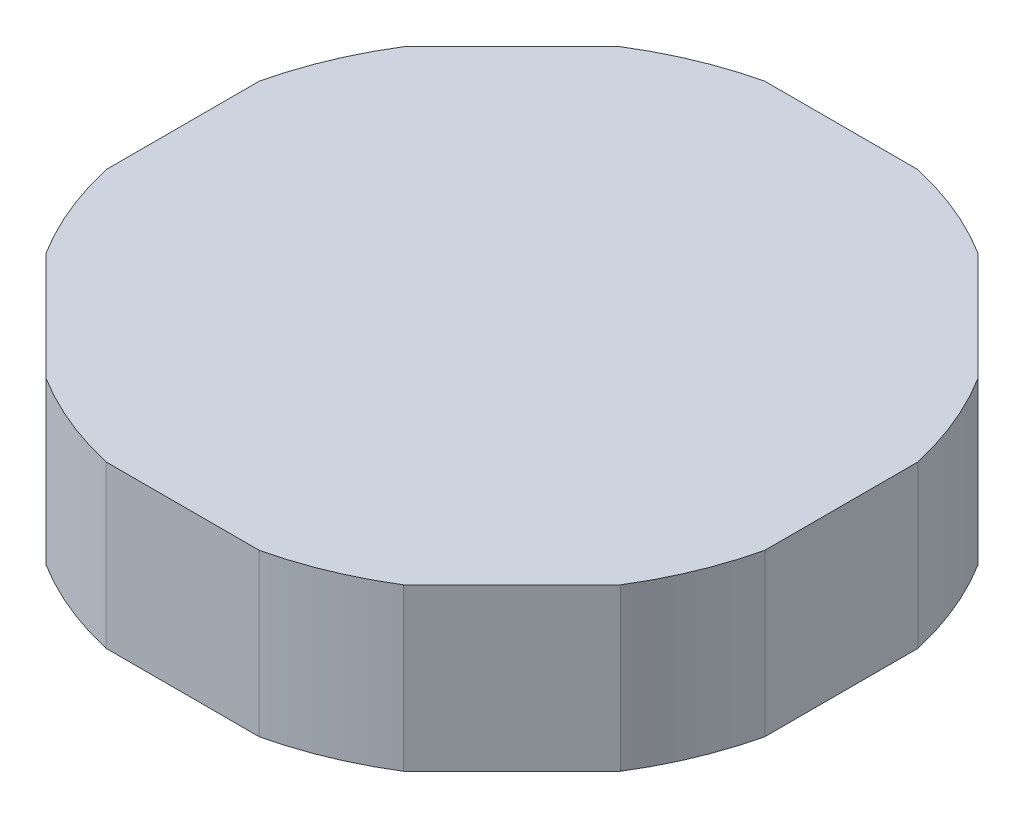
from build123d import *

# Parameters (mm, degrees)
SKETCH1_R           = 6.284997036
BOSS_EXTRUDE1_DEPTH = 3
SKETCH2_R           = 8.121320344
CUT_EXTRUDE1_DEPTH  = 10.380958133


with BuildPart() as part:
    # Sketch1 → Boss-Extrude1 (new body)
    with BuildSketch(Plane(origin=(0, 0, 0), x_dir=(1, 0, 0), z_dir=(0, 1, 0))):
        Circle(SKETCH1_R)
    extrude(amount=BOSS_EXTRUDE1_DEPTH)

    # Sketch2 → Cut-Extrude1 (cut, through all)
    with BuildSketch(Plane(origin=(0, 3, 0), x_dir=(1, 0, 0), z_dir=(0, 1, 0))):
        Circle(SKETCH2_R)
        Polygon((6.121320344, -2.535533906), (6.121320344, 2.535533906), (2.535533906, 6.121320344), (-2.535533906, 6.121320344), (-6.121320344, 2.535533906), (-6.121320344, -2.535533906), (-2.535533906, -6.121320344), (2.535533906, -6.121320344), align=None, mode=Mode.SUBTRACT)
    extrude(amount=-CUT_EXTRUDE1_DEPTH, mode=Mode.SUBTRACT)


solid = part.part
